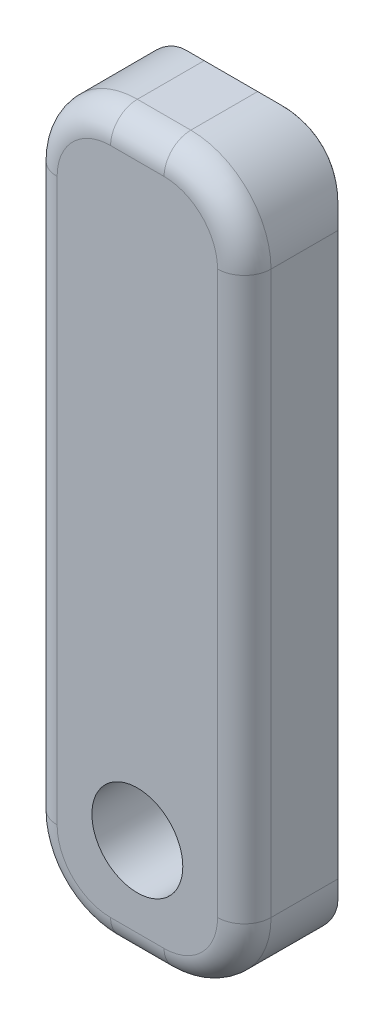
from build123d import *

# Parameters (mm, degrees)
SKETCH1_W           = 8
SKETCH1_H           = 27
SKETCH1_R           = 1.7
BOSS_EXTRUDE1_DEPTH = 5
CHAMFER1_SIZE       = 1.5
FILLET1_R           = 1
FILLET2_R           = 3


with BuildPart() as part:
    # Sketch1 → Boss-Extrude1 (new body)
    with BuildSketch(Plane.XY):
        Rectangle(SKETCH1_W, SKETCH1_H)
        with Locations((0, -9.5)):
            Circle(SKETCH1_R, mode=Mode.SUBTRACT)
    extrude(amount=BOSS_EXTRUDE1_DEPTH)

    # Chamfer1
    chamfer1_edges = [part.edges().sort_by_distance(p)[0] for p in [
        (0, -13.5, 0),
        (-4, 0, 0),
        (0, 13.5, 0),
        (4, 0, 0),
    ]]
    chamfer(chamfer1_edges, length=CHAMFER1_SIZE)

    # Fillet1
    fillet1_edges = [part.edges().sort_by_distance(p)[0] for p in [
        (-4, 0, 5),
        (0, -13.5, 5),
        (4, 0, 5),
        (0, 13.5, 5),
    ]]
    fillet(fillet1_edges, radius=FILLET1_R)

    # Fillet2
    # the kernel refuses this fillet: 3 mm, written as the material it takes off along each edge
    with BuildSketch(Plane(origin=(-1, 10.5, 5), x_dir=(0, 1, 0), z_dir=(1, 0, 0))) as fillet2_piece_1:
        with BuildLine():
            CenterArc((2, -1), 1, 0, 90)
            Line((3, -1), (3, 0))
            Line((3, 0), (2, 0))
        make_face()
    revolve(axis=Axis((-1, 10.5, 5), (0, 0, 1)), revolution_arc=90, mode=Mode.SUBTRACT)
    with BuildSketch(Plane(origin=(1, 10.5, 5), x_dir=(1, 0, 0), z_dir=(0, -1, 0))) as fillet2_piece_2:
        with BuildLine():
            CenterArc((2, -1), 1, 0, 90)
            Line((3, -1), (3, 0))
            Line((3, 0), (2, 0))
        make_face()
    revolve(axis=Axis((1, 10.5, 5), (0, 0, 1)), revolution_arc=90, mode=Mode.SUBTRACT)
    with BuildSketch(Plane(origin=(-1, -10.5, 5), x_dir=(-1, 0, 0), z_dir=(0, 1, 0))) as fillet2_piece_3:
        with BuildLine():
            CenterArc((2, -1), 1, 0, 90)
            Line((3, -1), (3, 0))
            Line((3, 0), (2, 0))
        make_face()
    revolve(axis=Axis((-1, -10.5, 5), (0, 0, 1)), revolution_arc=90, mode=Mode.SUBTRACT)
    with BuildSketch(Plane(origin=(1, -10.5, 5), x_dir=(0, -1, 0), z_dir=(-1, 0, 0))) as fillet2_piece_4:
        with BuildLine():
            CenterArc((2, -1), 1, 0, 90)
            Line((3, -1), (3, 0))
            Line((3, 0), (2, 0))
        make_face()
    revolve(axis=Axis((1, -10.5, 5), (0, 0, 1)), revolution_arc=90, mode=Mode.SUBTRACT)
    with BuildSketch(Plane(origin=(-6.5, 16, 4), x_dir=(0.816496580927726, 0.40824829046386274, 0.40824829046386324), z_dir=(0.5773502691896258, -0.5773502691896258, -0.5773502691896258)), Plane(origin=(-6.5, -16, 4), x_dir=(-0.4082482904638628, 0.816496580927726, 0.40824829046386335), z_dir=(0.5773502691896257, 0.5773502691896258, -0.5773502691896257))) as fillet2_piece_5:
        with BuildLine():
            CenterArc((FILLET2_R * 0.57735026919, FILLET2_R), FILLET2_R, 210, 60)
            Line((-FILLET2_R * 0.288675134595, FILLET2_R * 0.5), (0, 0))
            Line((0, 0), (FILLET2_R * 0.57735026919, 0))
        make_face()
    extrude(amount=11.258330249, mode=Mode.SUBTRACT)
    with BuildSketch(Plane(origin=(6.5, 16, 4), x_dir=(-0.8164965809277261, 0.4082482904638628, 0.4082482904638633), z_dir=(-0.5773502691896258, -0.5773502691896258, -0.5773502691896258)), Plane(origin=(6.5, -16, 4), x_dir=(0.4082482904638627, 0.8164965809277261, 0.4082482904638632), z_dir=(-0.5773502691896258, 0.5773502691896257, -0.5773502691896258))) as fillet2_piece_6:
        with BuildLine():
            CenterArc((FILLET2_R * 0.57735026919, -FILLET2_R), FILLET2_R, 90, 60)
            Line((-FILLET2_R * 0.288675134595, -FILLET2_R * 0.5), (0, 0))
            Line((0, 0), (FILLET2_R * 0.57735026919, 0))
        make_face()
    extrude(amount=11.258330249, mode=Mode.SUBTRACT)
    with BuildSketch(Plane(origin=(-4, -13.5, -6), x_dir=(0, 1, 0), z_dir=(0, 0, 1)), Plane(origin=(-4, 13.5, -6), x_dir=(1, 0, 0), z_dir=(0, 0, 1))) as fillet2_piece_7:
        with BuildLine():
            CenterArc((FILLET2_R, -FILLET2_R), FILLET2_R, 90, 90)
            Line((0, -FILLET2_R), (0, 0))
            Line((0, 0), (FILLET2_R, 0))
        make_face()
    extrude(amount=11, mode=Mode.SUBTRACT)
    with BuildSketch(Plane(origin=(4, -13.5, -6), x_dir=(0, 1, 0), z_dir=(0, 0, 1)), Plane(origin=(4, 13.5, -6), x_dir=(-1, 0, 0), z_dir=(0, 0, 1))) as fillet2_piece_8:
        with BuildLine():
            CenterArc((FILLET2_R, FILLET2_R), FILLET2_R, 180, 90)
            Line((0, FILLET2_R), (0, 0))
            Line((0, 0), (FILLET2_R, 0))
        make_face()
    extrude(amount=11, mode=Mode.SUBTRACT)


solid = part.part
